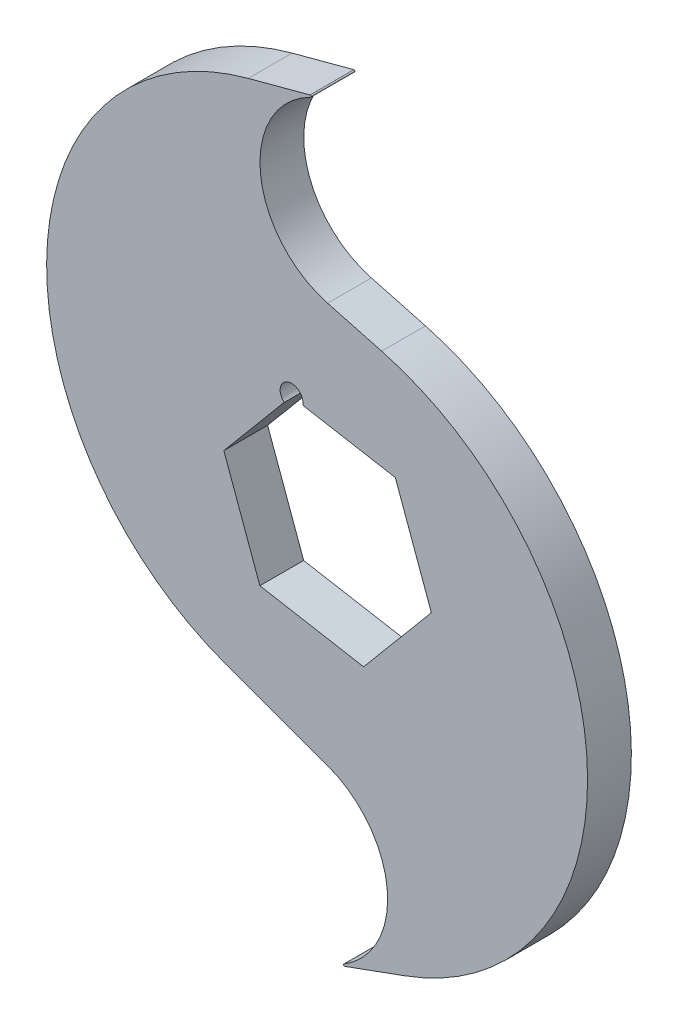
from build123d import *

# Parameters (mm, degrees)
BOSS_EXTRUDE1_DEPTH = 3.048
FILLET1_R           = 0.127


with BuildPart() as part:
    # Sketch1 → Boss-Extrude1 (new, symmetric)
    with BuildSketch(Plane.XY):
        with BuildLine():
            ThreePointArc((0, 27.535484012), (-9.412998127, 39.802742006), (0, 52.07))
            Line((0, 52.07), (-11.040532194, 49.111698314))
            ThreePointArc((-11.040532194, 49.111698314), (-39.066320922, 14.192289272), (-14.190605813, -23.03684931))
            Line((-14.190605813, -23.03684931), (0, -28.201807432))
            ThreePointArc((0, -28.201807432), (8.35634418, -40.135903716), (0, -52.07))
            Line((0, -52.07), (10.740686656, -48.160709762))
            ThreePointArc((10.740686656, -48.160709762), (36.144496882, -10.141220984), (7.52373904, 25.519504212))
            Line((7.52373904, 25.519504212), (0, 27.535484012))
        make_face()
        with BuildLine():
            Line((-14.441907141, 2.546497882), (-6.036047045, 12.564211851))
            ThreePointArc((-6.036047045, 12.564211851), (-5.686528205, 15.219071016), (-3.428121714, 13.780307404))
            ThreePointArc((-3.428121714, 13.780307404), (-3.434162631, 13.641947663), (-3.452239406, 13.504640922))
            Line((-3.452239406, 13.504640922), (9.426285427, 11.233809522))
            Line((9.426285427, 11.233809522), (14.441907141, -2.546497882))
            Line((14.441907141, -2.546497882), (5.015621714, -13.780307404))
            Line((5.015621714, -13.780307404), (-9.426285427, -11.233809522))
            Line((-9.426285427, -11.233809522), (-14.441907141, 2.546497882))
        make_face(mode=Mode.SUBTRACT)
    extrude(amount=BOSS_EXTRUDE1_DEPTH, both=True)

    # Fillet1
    fillet1_edges = [part.edges().sort_by_distance(p)[0] for p in [
        (0, 52.07, 0),
        (0, -52.07, 0),
    ]]
    fillet(fillet1_edges, radius=FILLET1_R)


solid = part.part
